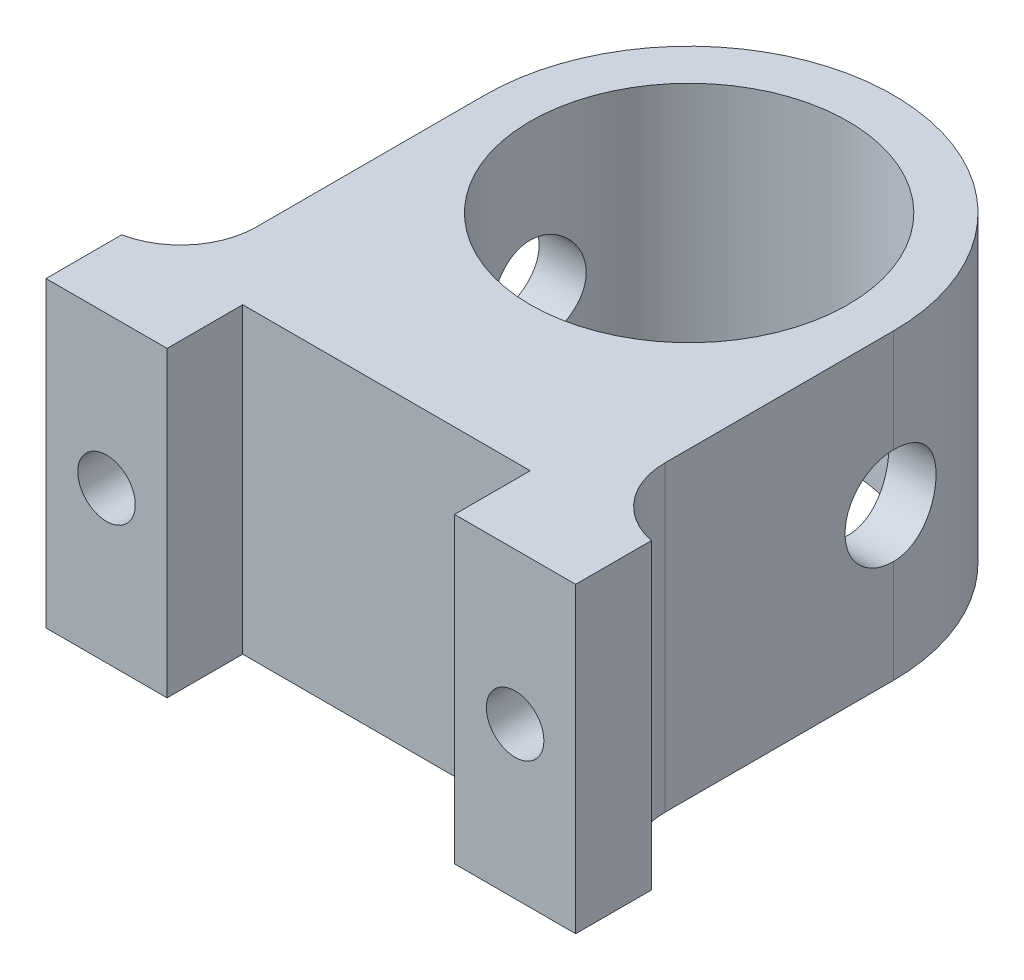
from build123d import *

# Parameters (mm, degrees)
SKETCH_1_R               = 13.5
SKETCH_1_R_2             = 10.5
EXTRUDE_1_DEPTH          = 20
EXTRUDE_2_REACH          = 43.286
EXTRUDE_2_END_RADIUS     = 13.5
SKETCH_5_W               = 27
SKETCH_5_H               = 20
CUT_EXTRUDE_2_DEPTH      = 32.340867888
CUT_EXTRUDE_2_DEPTH_BACK = 32.340867888
SKETCH_2_R               = 3.2
SKETCH_6_W               = 4
SKETCH_6_H               = 20
EXTRUDE_4_DEPTH          = 5
FILLET_1_R               = 5
SKETCH_7_R               = 1.9
CUT_EXTRUDE_3_DEPTH      = 5


with BuildPart() as part:
    # 草图1 → 凸台-拉伸1 (new body)
    with BuildSketch(Plane(origin=(0, 0, 0), x_dir=(1, 0, 0), z_dir=(0, 1, 0))):
        with Locations(Location((0, 0, 0), (0, 0, 270))):
            Circle(SKETCH_1_R)
        with Locations(Location((0, 0, 0), (0, 0, 270))):
            Circle(SKETCH_1_R_2, mode=Mode.SUBTRACT)
    extrude(amount=EXTRUDE_1_DEPTH)

    # 凸台-拉伸2: up to this cylinder (the profile starts outside it)
    extrude_2_end = Plane(origin=(0, 10, 0), z_dir=(0, -1, 0)) * Cylinder(EXTRUDE_2_END_RADIUS, 114.572, mode=Mode.PRIVATE)
    # 草图5 → 凸台-拉伸2 (add, up to the surface)
    with BuildSketch(Plane.XY.offset(20), mode=Mode.PRIVATE) as extrude_2_sk1:
        with Locations((0, 10)):
            Rectangle(SKETCH_5_W, SKETCH_5_H)
    extrude_2_tool1 = extrude(extrude_2_sk1.sketch, amount=-EXTRUDE_2_REACH, mode=Mode.PRIVATE) - extrude_2_end
    add(extrude_2_tool1.solids().sort_by_distance((0, 10, 20))[0])

    # 草图2 → 切除-拉伸2 (cut, two sides: drawn at the far end of the back side and taken through both)
    with BuildSketch(Plane(origin=(0, 0, 0), x_dir=(0, 0, -1), z_dir=(1, 0, 0)).offset(-CUT_EXTRUDE_2_DEPTH_BACK)):
        with Locations((0, 10)):
            Circle(SKETCH_2_R)
    extrude(amount=CUT_EXTRUDE_2_DEPTH + CUT_EXTRUDE_2_DEPTH_BACK, mode=Mode.SUBTRACT)

    # 草图6 → 凸台-拉伸4 (add)
    with BuildSketch(Plane.XY.offset(20)):
        with Locations((15.5, 10)):
            Rectangle(SKETCH_6_W, SKETCH_6_H)
        with Locations((11.5, 10)):
            Rectangle(SKETCH_6_W, SKETCH_6_H)
        with Locations((-11.5, 10)):
            Rectangle(SKETCH_6_W, SKETCH_6_H)
        with Locations((-15.5, 10)):
            Rectangle(SKETCH_6_W, SKETCH_6_H)
    extrude(amount=EXTRUDE_4_DEPTH)

    # 圆角1
    # the kernel refuses this fillet: 5 mm, written as the material it adds along each edge
    with BuildSketch(Plane(origin=(13.5, 20, 20), x_dir=(0, 0, -1), z_dir=(0, -1, 0)), Plane(origin=(-13.5, 0, 20), x_dir=(0, 0, -1), z_dir=(0, 1, 0))) as fillet_1_piece_1:
        with BuildLine():
            CenterArc((4.898979486, 5), FILLET_1_R, 191.536959033, 78.463040967)
            Line((0, 4), (-0.09797959, 3.98))
            ThreePointArc((-0.09797959, 3.98), (-0.1, 2), (-0.1, 0))
            Line((-0.1, 0), (0, -0.1))
            Line((0, -0.1), (4.898979486, -0.1))
            Line((4.898979486, -0.1), (4.898979486, 0))
        make_face()
    extrude(amount=20)

    # 草图7 → 切除-拉伸3 (cut)
    with BuildSketch(Plane.XY.offset(25)):
        with Locations((13.5, 10)):
            Circle(SKETCH_7_R)
        with Locations(Location((-13.5, 10, 0), (0, 0, 180))):
            Circle(SKETCH_7_R)
    extrude(amount=-CUT_EXTRUDE_3_DEPTH, mode=Mode.SUBTRACT)


solid = part.part
